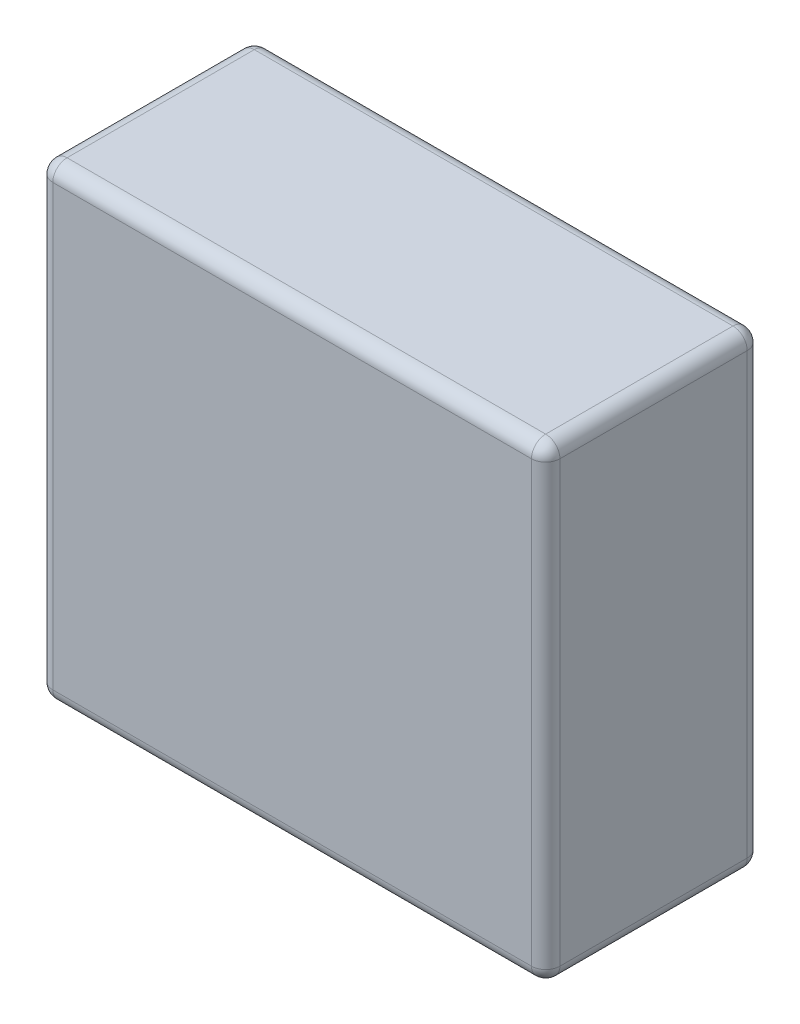
from build123d import *

# Parameters (mm, degrees)
SKETCH2_W           = 77
SKETCH2_H           = 167
BOSS_EXTRUDE1_DEPTH = 181
FILLET1_R           = 5.08


with BuildPart() as part:
    # Sketch2 → Boss-Extrude1 (new body)
    with BuildSketch(Plane(origin=(0, 0, 0), x_dir=(0, 0, -1), z_dir=(1, 0, 0))):
        with Locations((38.5, 83.5)):
            Rectangle(SKETCH2_W, SKETCH2_H)
    extrude(amount=BOSS_EXTRUDE1_DEPTH)

    # Fillet1
    fillet1_edges = [part.edges().sort_by_distance(p)[0] for p in [
        (0, 0, -38.5),
        (90.5, 0, 0),
        (90.5, 0, -77),
        (181, 0, -38.5),
        (181, 83.5, -77),
        (181, 167, -38.5),
        (181, 83.5, 0),
        (90.5, 167, -77),
        (0, 83.5, -77),
        (0, 83.5, 0),
        (0, 167, -38.5),
        (90.5, 167, 0),
    ]]
    fillet(fillet1_edges, radius=FILLET1_R)


solid = part.part
